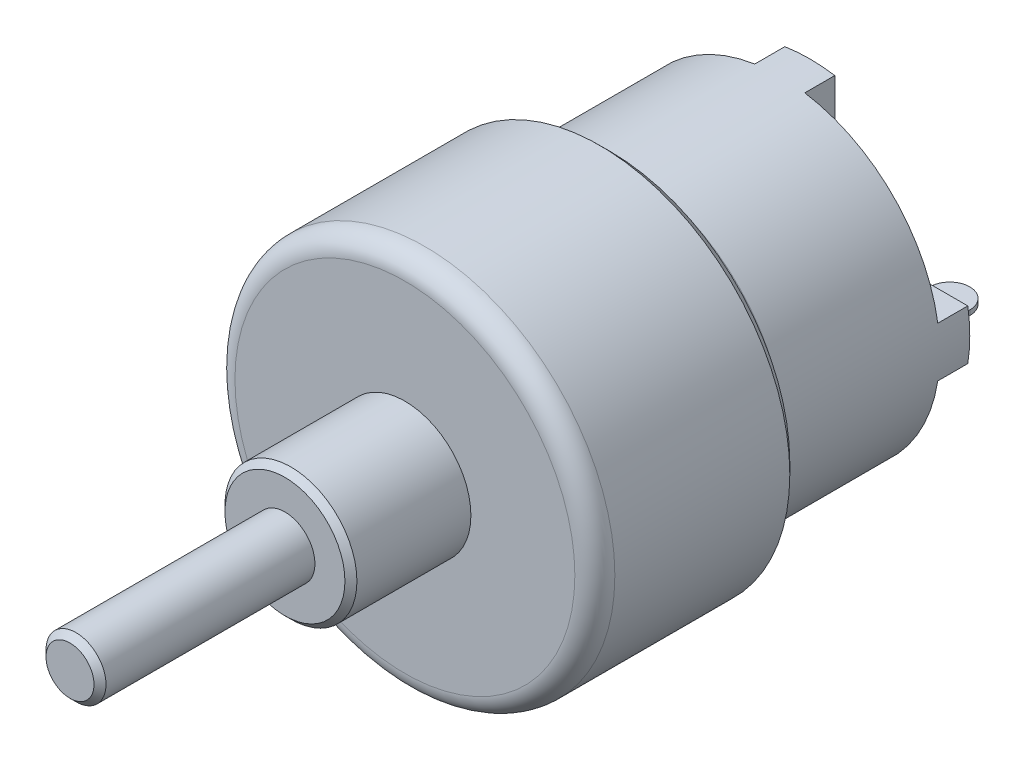
from build123d import *
from build123d.topology import SkipClean

# Parameters (mm, degrees)
SKETCH1_R           = 16
BOSS_EXTRUDE1_DEPTH = 17
FILLET1_R           = 1.5
BOSS_EXTRUDE2_START = 3
BOSS_EXTRUDE2_DEPTH = 3
CIRPATTERN1_COUNT   = 4
FILLET2_R           = 1.5
SKETCH5_R           = 3
BOSS_EXTRUDE3_DEPTH = 3
FILLET3_R           = 0.5
SKETCH6_R           = 19
BOSS_EXTRUDE4_DEPTH = 20.5
CHAMFER1_SIZE       = 1
SKETCH7_W           = 4
SKETCH7_H           = 0.5
BOSS_EXTRUDE5_DEPTH = 4
FILLET4_R           = 2
FILLET5_R           = 2
SKETCH8_R           = 6.6
BOSS_EXTRUDE6_DEPTH = 12
BOSS_EXTRUDE7_START = 21.5
SKETCH9_R           = 3
BOSS_EXTRUDE7_DEPTH = 21.5
CHAMFER2_SIZE       = 0.6
CHAMFER3_SIZE       = 0.6


with BuildPart() as part:
    # Sketch1 → Boss-Extrude1 (new body)
    with BuildSketch(Plane.XY):
        Circle(SKETCH1_R)
    extrude(amount=BOSS_EXTRUDE1_DEPTH)

    # Fillet1
    fillet1_edges = [part.edges().sort_by_distance(p)[0] for p in [
        (-16, 0, 17),
    ]]
    fillet(fillet1_edges, radius=FILLET1_R)

    # Sketch3 → Boss-Extrude2 (add)
    with SkipClean():  # the faces are left unmerged after this step: merging them gives an invalid solid
        with BuildSketch(Plane(origin=(0, 0, 0), x_dir=(-1, 0, 0), z_dir=(0, 0, -1)).offset(BOSS_EXTRUDE2_START)):
            with BuildLine():
                Line((-2.5, 15.803481), (-2.5, -15.803481))
                ThreePointArc((-2.5, -15.803481), (0, -16), (2.5, -15.803481))
                Line((2.5, -15.803481), (2.5, 15.803481))
                ThreePointArc((2.5, 15.803481), (0, 16), (-2.5, 15.803481))
            make_face()
        boss_extrude2 = extrude(amount=-BOSS_EXTRUDE2_DEPTH)

    # CirPattern1: Boss-Extrude2 ×4 about axis
    with SkipClean():  # the faces are left unmerged after this step: merging them gives an invalid solid
        cirpattern1_axis = Axis((0, 0, 0), (0, 0, -1))
        for i in range(1, CIRPATTERN1_COUNT):
            add(boss_extrude2.rotate(cirpattern1_axis, i * 360 / CIRPATTERN1_COUNT))

    # Fillet2
    fillet2_edges = [part.edges().sort_by_distance(p)[0] for p in [
        (-2.5, 2.5, -1.5),
        (2.5, 2.5, -1.5),
        (-2.5, -2.5, -1.5),
        (2.5, -2.5, -1.5),
    ]]
    fillet(fillet2_edges, radius=FILLET2_R)

    # Sketch5 → Boss-Extrude3 (add)
    with SkipClean():  # the faces are left unmerged after this step: merging them gives an invalid solid
        with BuildSketch(Plane(origin=(0, 0, -3), x_dir=(-1, 0, 0), z_dir=(0, 0, -1))):
            Circle(SKETCH5_R)
        extrude(amount=BOSS_EXTRUDE3_DEPTH)

    # Fillet3
    fillet3_edges = [part.edges().sort_by_distance(p)[0] for p in [
        (3, 0, -6),
    ]]
    fillet(fillet3_edges, radius=FILLET3_R)

    # Sketch6 → Boss-Extrude4 (add)
    with SkipClean():  # the faces are left unmerged after this step: merging them gives an invalid solid
        with BuildSketch(Plane.XY.offset(17)):
            Circle(SKETCH6_R)
        extrude(amount=BOSS_EXTRUDE4_DEPTH)

    # Chamfer1
    chamfer1_edges = [part.edges().sort_by_distance(p)[0] for p in [
        (-19, 0, 17),
    ]]
    chamfer(chamfer1_edges, length=CHAMFER1_SIZE)

    # Sketch7 → Boss-Extrude5 (add)
    with SkipClean():  # the faces are left unmerged after this step: merging them gives an invalid solid
        with BuildSketch(Plane(origin=(0, 0, -3), x_dir=(-1, 0, 0), z_dir=(0, 0, -1))):
            with Locations((12, 0)):
                Rectangle(SKETCH7_W, SKETCH7_H)
            with Locations((-12, 0)):
                Rectangle(SKETCH7_W, SKETCH7_H)
        extrude(amount=BOSS_EXTRUDE5_DEPTH)

    # Fillet4
    fillet4_edges = [part.edges().sort_by_distance(p)[0] for p in [
        (14, 0, -7),
        (10, 0, -7),
        (-10, 0, -7),
        (-14, 0, -7),
    ]]
    fillet(fillet4_edges, radius=FILLET4_R - 0.0001)  # a hair under: the kernel refuses the full size

    # Fillet5
    fillet5_edges = [part.edges().sort_by_distance(p)[0] for p in [
        (-19, 0, 37.5),
    ]]
    fillet(fillet5_edges, radius=FILLET5_R)

    # Sketch8 → Boss-Extrude6 (add)
    with BuildSketch(Plane.XY.offset(37.5)):
        Circle(SKETCH8_R)
    extrude(amount=BOSS_EXTRUDE6_DEPTH)

    # Sketch9 → Boss-Extrude7 (add)
    with BuildSketch(Plane.XY.offset(49.5).offset(BOSS_EXTRUDE7_START)):
        with Locations(Location((0, 0, 0), (0, 0, 180))):
            Circle(SKETCH9_R)
    extrude(amount=-BOSS_EXTRUDE7_DEPTH)

    # Chamfer2
    chamfer2_edges = [part.edges().sort_by_distance(p)[0] for p in [
        (3, 0, 71),
    ]]
    chamfer(chamfer2_edges, length=CHAMFER2_SIZE)

    # Chamfer3
    chamfer3_edges = [part.edges().sort_by_distance(p)[0] for p in [
        (-6.6, 0, 49.5),
    ]]
    chamfer(chamfer3_edges, length=CHAMFER3_SIZE)


solid = part.part
